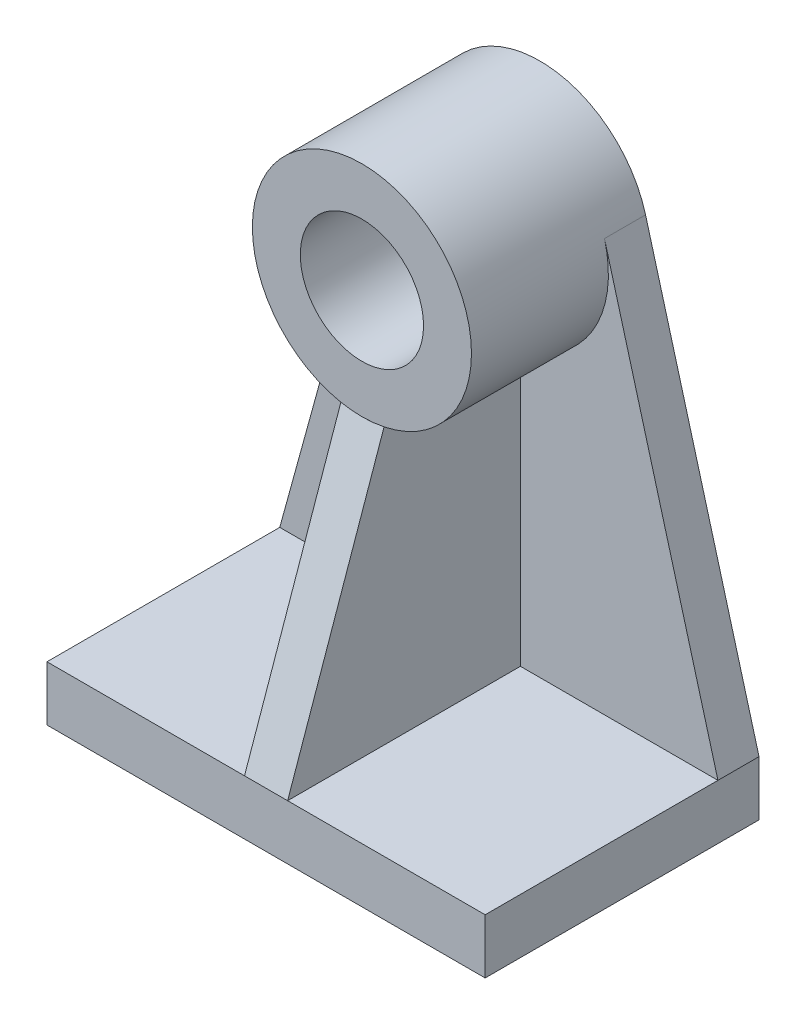
from build123d import *

# Parameters (mm, degrees)
BASE_EXTRUDE_DEPTH  = 9.525
BOSS_EXTRUDE1_DEPTH = 53.974999999999994
SKETCH3_R           = 25.400000000000002
BOSS_EXTRUDE2_DEPTH = 31.75
SKETCH4_R           = 14.287500000000001
CUT_EXTRUDE1_DEPTH  = 121.85870107278168
RIB1_REACH          = 132.136
SKETCH5_WALL_W      = 329.54959327419806
SKETCH5_WALL_H      = 10


with BuildPart() as part:
    # Sketch1 → Base-Extrude (new body)
    with BuildSketch(Plane.XY):
        with BuildLine():
            Line((-50.800000000000004, -101.6), (50.79999999999999, -101.59999999999998))
            Line((50.79999999999999, -101.59999999999998), (50.79999999999999, -88.9))
            Line((50.79999999999999, -88.9), (24.490190651941575, 6.737251801109487))
            ThreePointArc((24.490190651941575, 6.737251801109487), (-4.08e-15, 25.39999999999999), (-24.490190651941617, 6.737251801109478))
            Line((-24.490190651941617, 6.737251801109478), (-50.79999999999999, -88.90000000000002))
            Line((-50.79999999999999, -88.90000000000002), (-50.800000000000004, -101.6))
        make_face()
    extrude(amount=BASE_EXTRUDE_DEPTH)

    # Sketch2 → Boss-Extrude1 (add)
    with BuildSketch(Plane.XY.offset(9.525)):
        Polygon((50.79999999999999, -101.59999999999998), (50.79999999999999, -88.9), (-50.79999999999999, -88.90000000000002), (-50.800000000000004, -101.6), align=None)
    extrude(amount=BOSS_EXTRUDE1_DEPTH)

    # Sketch3 → Boss-Extrude2 (add)
    with BuildSketch(Plane.XY.offset(9.525)):
        Circle(SKETCH3_R)
    extrude(amount=BOSS_EXTRUDE2_DEPTH)

    # Sketch4 → Cut-Extrude1 (cut, through all)
    with BuildSketch(Plane.XY.offset(41.275)):
        Circle(SKETCH4_R)
    extrude(amount=-CUT_EXTRUDE1_DEPTH, mode=Mode.SUBTRACT)

    # Sketch5 wall → Rib1 (add, up to next)
    with BuildSketch(Plane(origin=(0, -57.15, 52.3875), x_dir=(0, 0.943858356366, -0.330350424728), z_dir=(0, 0.330350424728, 0.943858356366)), mode=Mode.PRIVATE) as rib1_sk1:
        Rectangle(SKETCH5_WALL_W, SKETCH5_WALL_H)
    rib1_tool1 = extrude(rib1_sk1.sketch, amount=-RIB1_REACH, mode=Mode.PRIVATE) - part.part
    add(rib1_tool1.solids().sort_by_distance((0, -57.15, 52.3875))[0])


solid = part.part
